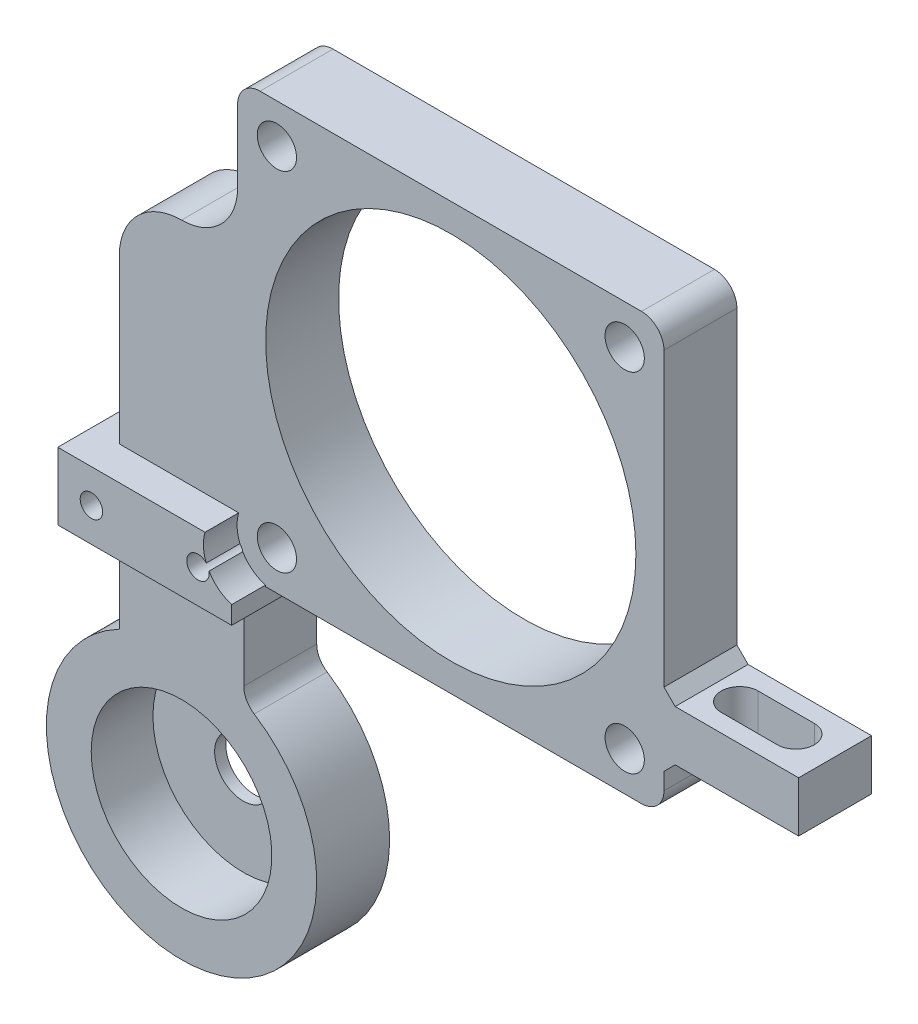
from build123d import *
from build123d.topology import SkipClean

# Parameters (mm, degrees)
SKETCH1_R           = 8.05
SKETCH1_R_2         = 1.75
SKETCH1_R_3         = 12.5
BOSS_EXTRUDE3_DEPTH = 6.5
SKETCH1_5_R         = 2.55
BOSS_EXTRUDE2_DEPTH = 1
CUT_EXTRUDE1_DEPTH  = 10
FILLET2_R           = 2
FILLET5_R           = 5
CHAMFER2_SIZE       = 1
FILLET1_R           = 2
SKETCH5_R           = 16.5
CUT_EXTRUDE2_DEPTH  = 10
SKETCH4_R           = 1
CUT_EXTRUDE3_DEPTH  = 10
SKETCH4_4_W         = 1.918871126
SKETCH4_4_H         = 1.5
BOSS_EXTRUDE4_DEPTH = 6.5
SKETCH4_5_W         = 15.5
SKETCH4_5_H         = 6
BOSS_EXTRUDE5_DEPTH = 3
CUT_EXTRUDE5_START  = 9
SKETCH4_6_R         = 1
CUT_EXTRUDE5_DEPTH  = 9
SKETCH6_R           = 3.55
CUT_EXTRUDE6_DEPTH  = 8


with BuildPart() as part:
    # Sketch1 → Boss-Extrude3 (new body)
    with BuildSketch(Plane.XY):
        with BuildLine():
            ThreePointArc((-5.55, 10.695793566), (0, -12.05), (5.55, 10.695793566))
            Line((5.55, 10.695793566), (5.55, 20.5))
            Line((5.55, 20.5), (43, 20.5))
            Line((43, 20.5), (43, 25))
            Line((43, 25), (55, 25))
            Line((55, 25), (55, 29.5))
            Line((55, 29.5), (43, 29.5))
            Line((43, 29.5), (43, 58.5))
            Line((43, 58.5), (5, 58.5))
            Line((5, 58.5), (5, 45.05))
            Line((5, 45.05), (0, 45.05))
            ThreePointArc((0, 45.05), (-3.924442636, 43.424442636), (-5.55, 39.5))
            Line((-5.55, 39.5), (-5.55, 10.695793566))
        make_face()
        with Locations(Location((0, 0, 0), (0, 0, 180))):
            Circle(SKETCH1_R, mode=Mode.SUBTRACT)
        with Locations(Location((8.5, 24, 0), (0, 0, 180))):
            Circle(SKETCH1_R_2, mode=Mode.SUBTRACT)
        with Locations(Location((39.5, 24, 0), (0, 0, 180))):
            Circle(SKETCH1_R_2, mode=Mode.SUBTRACT)
        with Locations(Location((8.5, 55, 0), (0, 0, 180))):
            Circle(SKETCH1_R_2, mode=Mode.SUBTRACT)
        with Locations(Location((24, 39.5, 0), (0, 0, 180))):
            Circle(SKETCH1_R_3, mode=Mode.SUBTRACT)
        with Locations(Location((39.5, 55, 0), (0, 0, 180))):
            Circle(SKETCH1_R_2, mode=Mode.SUBTRACT)
    extrude(amount=BOSS_EXTRUDE3_DEPTH)

    # Sketch1<5> → Boss-Extrude2 (add)
    # profile 1 of 2: a face of its own
    with BuildSketch(Plane.XY):
        with BuildLine():
            Line((-5.55, 5.830951895), (-5.55, 0))
            ThreePointArc((-5.55, 0), (0, -5.55), (5.55, 0))
            Line((5.55, 0), (5.55, 5.830951895))
            ThreePointArc((5.55, 5.830951895), (0, 8.05), (-5.55, 5.830951895))
        make_face()
        Circle(SKETCH1_5_R, mode=Mode.SUBTRACT)
    # profile 2 of 2: a face of its own
    with BuildSketch(Plane.XY):
        with BuildLine():
            ThreePointArc((5.55, 0), (0, -5.55), (-5.55, 0))
            Line((-5.55, 0), (-5.55, 5.830951895))
            ThreePointArc((-5.55, 5.830951895), (-3.172144385, -7.398648525), (8.05, 0))
            ThreePointArc((8.05, 0), (7.398648525, 3.172144385), (5.55, 5.830951895))
            Line((5.55, 5.830951895), (5.55, 0))
        make_face()
    extrude(amount=BOSS_EXTRUDE2_DEPTH)

    # Sketch3 → Cut-Extrude1 (cut)
    with BuildSketch(Plane(origin=(0, 29.5, 0), x_dir=(1, 0, 0), z_dir=(0, 1, 0))):
        with BuildLine():
            Line((46.5, -1.6), (51.5, -1.6))
            ThreePointArc((51.5, -1.6), (53.15, -3.25), (51.5, -4.9))
            Line((51.5, -4.9), (46.5, -4.9))
            ThreePointArc((46.5, -4.9), (44.85, -3.25), (46.5, -1.6))
        make_face()
    extrude(amount=-CUT_EXTRUDE1_DEPTH, mode=Mode.SUBTRACT)

    # Fillet2
    fillet2_edges = [part.edges().sort_by_distance(p)[0] for p in [
        (5.55, 20.5, 3.25),
        (5.55, 10.695793566, 3.25),
    ]]
    fillet(fillet2_edges, radius=FILLET2_R)

    # Fillet5
    fillet5_edges = [part.edges().sort_by_distance(p)[0] for p in [
        (5, 45.05, 3.25),
    ]]
    fillet(fillet5_edges, radius=FILLET5_R - 0.0001)  # a hair under: the kernel refuses the full size

    # Chamfer2
    chamfer2_edges = [part.edges().sort_by_distance(p)[0] for p in [
        (43, 29.5, 3.25),
        (43, 25, 3.25),
    ]]
    chamfer(chamfer2_edges, length=CHAMFER2_SIZE)

    # Fillet1
    fillet1_edges = [part.edges().sort_by_distance(p)[0] for p in [
        (43, 20.5, 3.25),
        (5, 58.5, 3.25),
        (43, 58.5, 3.25),
    ]]
    fillet(fillet1_edges, radius=FILLET1_R)

    # Sketch5 → Cut-Extrude2 (cut)
    with BuildSketch(Plane.XY.offset(6.5)):
        with Locations((24, 39.5)):
            Circle(SKETCH5_R)
    extrude(amount=-CUT_EXTRUDE2_DEPTH, mode=Mode.SUBTRACT)

    # Sketch4 → Cut-Extrude3 (cut)
    with BuildSketch(Plane.XY.offset(6.5)):
        with Locations((4.468871126, 22)):
            Circle(SKETCH4_R)
        with Locations((-5.031128874, 22)):
            Circle(SKETCH4_R)
    extrude(amount=-CUT_EXTRUDE3_DEPTH, mode=Mode.SUBTRACT)

    # Sketch4<4> → Boss-Extrude4 (add)
    with BuildSketch(Plane.XY.offset(6.5)):
        with BuildLine():
            Line((-8.031128874, 25), (-8.031128874, 19))
            Line((-8.031128874, 19), (-5.55, 19))
            Line((-5.55, 19), (-5.55, 21.145147525))
            ThreePointArc((-5.55, 21.145147525), (-6.031128874, 22), (-5.55, 22.854852475))
            Line((-5.55, 22.854852475), (-5.55, 25))
            Line((-5.55, 25), (-8.031128874, 25))
        make_face()
        with Locations((6.509435563, 19.75)):
            Rectangle(SKETCH4_4_W, SKETCH4_4_H)
    extrude(amount=-BOSS_EXTRUDE4_DEPTH)

    # Sketch4<5> → Boss-Extrude5 (add)
    with BuildSketch(Plane.XY.offset(6.5)):
        with Locations((-0.281128874, 22)):
            Rectangle(SKETCH4_5_W, SKETCH4_5_H)
    extrude(amount=BOSS_EXTRUDE5_DEPTH)

    # Sketch4<6> → Cut-Extrude5 (cut)
    with SkipClean():  # the faces are left unmerged after this step: merging them gives an invalid solid
        with BuildSketch(Plane.XY.offset(6.5).offset(CUT_EXTRUDE5_START)):
            with Locations((4.468871126, 22)):
                Circle(SKETCH4_6_R)
            with Locations((-5.031128874, 22)):
                Circle(SKETCH4_6_R)
        extrude(amount=-CUT_EXTRUDE5_DEPTH, mode=Mode.SUBTRACT)
    add(part.part.scale(1), mode=Mode.REPLACE)  # the faces are merged on a copy

    # Sketch6 → Cut-Extrude6 (cut)
    with SkipClean():  # the faces are left unmerged after this step: merging them gives an invalid solid
        with BuildSketch(Plane.XY.offset(6.5)):
            with Locations((8.5, 24)):
                Circle(SKETCH6_R)
        extrude(amount=CUT_EXTRUDE6_DEPTH, mode=Mode.SUBTRACT)


solid = part.part
